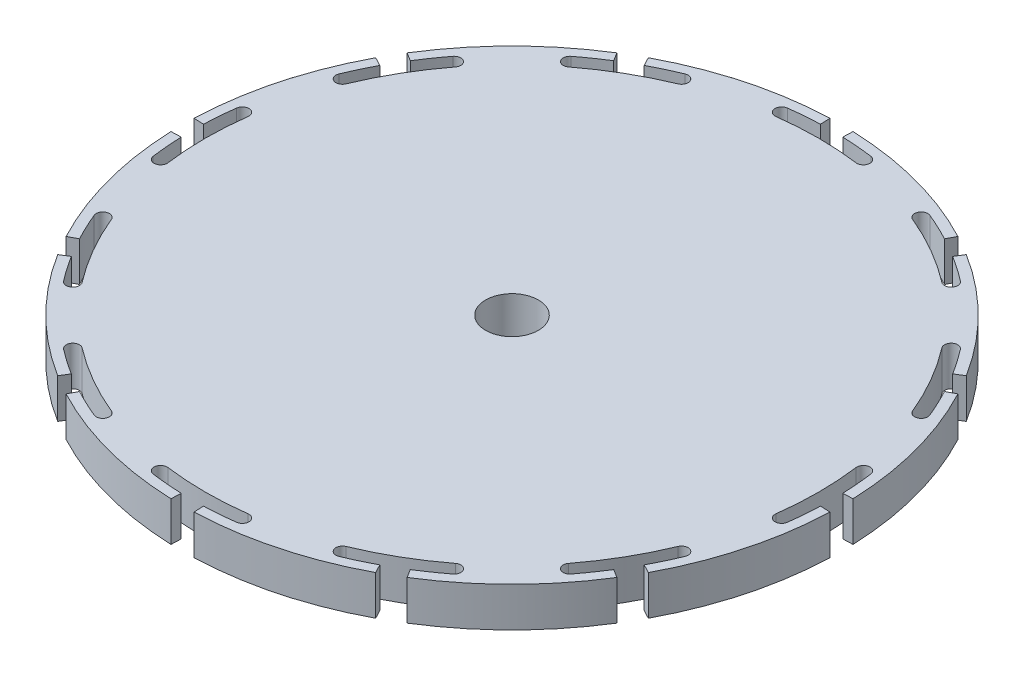
from build123d import *

# Parameters (mm, degrees)
SKETCH1_R           = 50
BOSS_EXTRUDE1_DEPTH = 6
CUT_EXTRUDE1_DEPTH  = 71.964779997
SKETCH3_R           = 4
CUT_EXTRUDE2_DEPTH  = 6


with BuildPart() as part:
    # Sketch1 → Boss-Extrude1 (new body)
    with BuildSketch(Plane(origin=(0, 0, 0), x_dir=(1, 0, 0), z_dir=(0, 1, 0))):
        Circle(SKETCH1_R)
    extrude(amount=BOSS_EXTRUDE1_DEPTH)

    # Sketch2 → Cut-Extrude1 (cut, through all)
    with BuildSketch(Plane(origin=(0, 0, 0), x_dir=(1, 0, 0), z_dir=(0, 1, 0))):
        with BuildLine():
            Line((-1.744974835, 49.969541351), (-1.69262559, 48.47045511))
            ThreePointArc((-1.69262559, 48.47045511), (-4.016198064, 48.333426871), (-6.330520323, 48.085075777))
            ThreePointArc((-6.330520323, 48.085075777), (-7.191438992, 46.963104723), (-6.069467938, 46.102186054))
            ThreePointArc((-6.069467938, 46.102186054), (0, 46.5), (6.069467938, 46.102186054))
            ThreePointArc((6.069467938, 46.102186054), (7.191438992, 46.963104723), (6.330520323, 48.085075777))
            ThreePointArc((6.330520323, 48.085075777), (4.016198064, 48.333426871), (1.69262559, 48.47045511))
            Line((1.69262559, 48.47045511), (1.744974835, 49.969541351))
            ThreePointArc((1.744974835, 49.969541351), (0, 50), (-1.744974835, 49.969541351))
        make_face()
        with BuildLine():
            Line((23.473578139, 44.147379643), (22.769370795, 42.822958254))
            ThreePointArc((22.769370795, 42.822958254), (20.688583885, 43.866074555), (18.56014647, 44.808157327))
            ThreePointArc((18.56014647, 44.808157327), (17.253583505, 44.266961227), (17.794779605, 42.960398262))
            ThreePointArc((17.794779605, 42.960398262), (23.25, 40.270181276), (28.307406449, 36.890930324))
            ThreePointArc((28.307406449, 36.890930324), (29.709521218, 37.075522235), (29.524929307, 38.477637004))
            ThreePointArc((29.524929307, 38.477637004), (27.644842986, 39.84987649), (25.701084315, 41.130332664))
            Line((25.701084315, 41.130332664), (26.495963212, 42.402404808))
            ThreePointArc((26.495963212, 42.402404808), (25, 43.301270189), (23.473578139, 44.147379643))
        make_face()
        with BuildLine():
            Line((42.402404808, 26.495963212), (41.130332664, 25.701084315))
            ThreePointArc((41.130332664, 25.701084315), (39.84987649, 27.644842986), (38.477637004, 29.524929307))
            ThreePointArc((38.477637004, 29.524929307), (37.075522235, 29.709521218), (36.890930324, 28.307406449))
            ThreePointArc((36.890930324, 28.307406449), (40.270181276, 23.25), (42.960398262, 17.794779605))
            ThreePointArc((42.960398262, 17.794779605), (44.266961227, 17.253583505), (44.808157327, 18.56014647))
            ThreePointArc((44.808157327, 18.56014647), (43.866074555, 20.688583885), (42.822958254, 22.769370795))
            Line((42.822958254, 22.769370795), (44.147379643, 23.473578139))
            ThreePointArc((44.147379643, 23.473578139), (43.301270189, 25), (42.402404808, 26.495963212))
        make_face()
        with BuildLine():
            Line((49.969541351, 1.744974835), (48.47045511, 1.69262559))
            ThreePointArc((48.47045511, 1.69262559), (48.333426871, 4.016198064), (48.085075777, 6.330520323))
            ThreePointArc((48.085075777, 6.330520323), (46.963104723, 7.191438992), (46.102186054, 6.069467938))
            ThreePointArc((46.102186054, 6.069467938), (46.5, 0), (46.102186054, -6.069467938))
            ThreePointArc((46.102186054, -6.069467938), (46.963104723, -7.191438992), (48.085075777, -6.330520323))
            ThreePointArc((48.085075777, -6.330520323), (48.333426871, -4.016198064), (48.47045511, -1.69262559))
            Line((48.47045511, -1.69262559), (49.969541351, -1.744974835))
            ThreePointArc((49.969541351, -1.744974835), (50, 0), (49.969541351, 1.744974835))
        make_face()
        with BuildLine():
            Line((44.147379643, -23.473578139), (42.822958254, -22.769370795))
            ThreePointArc((42.822958254, -22.769370795), (43.866074555, -20.688583885), (44.808157327, -18.56014647))
            ThreePointArc((44.808157327, -18.56014647), (44.266961227, -17.253583505), (42.960398262, -17.794779605))
            ThreePointArc((42.960398262, -17.794779605), (40.270181276, -23.25), (36.890930324, -28.307406449))
            ThreePointArc((36.890930324, -28.307406449), (37.075522235, -29.709521218), (38.477637004, -29.524929307))
            ThreePointArc((38.477637004, -29.524929307), (39.84987649, -27.644842986), (41.130332664, -25.701084315))
            Line((41.130332664, -25.701084315), (42.402404808, -26.495963212))
            ThreePointArc((42.402404808, -26.495963212), (43.301270189, -25), (44.147379643, -23.473578139))
        make_face()
        with BuildLine():
            Line((26.495963212, -42.402404808), (25.701084315, -41.130332664))
            ThreePointArc((25.701084315, -41.130332664), (27.644842986, -39.84987649), (29.524929307, -38.477637004))
            ThreePointArc((29.524929307, -38.477637004), (29.709521218, -37.075522235), (28.307406449, -36.890930324))
            ThreePointArc((28.307406449, -36.890930324), (23.25, -40.270181276), (17.794779605, -42.960398262))
            ThreePointArc((17.794779605, -42.960398262), (17.253583505, -44.266961227), (18.56014647, -44.808157327))
            ThreePointArc((18.56014647, -44.808157327), (20.688583885, -43.866074555), (22.769370795, -42.822958254))
            Line((22.769370795, -42.822958254), (23.473578139, -44.147379643))
            ThreePointArc((23.473578139, -44.147379643), (25, -43.301270189), (26.495963212, -42.402404808))
        make_face()
        with BuildLine():
            Line((1.744974835, -49.969541351), (1.69262559, -48.47045511))
            ThreePointArc((1.69262559, -48.47045511), (4.016198064, -48.333426871), (6.330520323, -48.085075777))
            ThreePointArc((6.330520323, -48.085075777), (7.191438992, -46.963104723), (6.069467938, -46.102186054))
            ThreePointArc((6.069467938, -46.102186054), (0, -46.5), (-6.069467938, -46.102186054))
            ThreePointArc((-6.069467938, -46.102186054), (-7.191438992, -46.963104723), (-6.330520323, -48.085075777))
            ThreePointArc((-6.330520323, -48.085075777), (-4.016198064, -48.333426871), (-1.69262559, -48.47045511))
            Line((-1.69262559, -48.47045511), (-1.744974835, -49.969541351))
            ThreePointArc((-1.744974835, -49.969541351), (0, -50), (1.744974835, -49.969541351))
        make_face()
        with BuildLine():
            Line((-23.473578139, -44.147379643), (-22.769370795, -42.822958254))
            ThreePointArc((-22.769370795, -42.822958254), (-20.688583885, -43.866074555), (-18.56014647, -44.808157327))
            ThreePointArc((-18.56014647, -44.808157327), (-17.253583505, -44.266961227), (-17.794779605, -42.960398262))
            ThreePointArc((-17.794779605, -42.960398262), (-23.25, -40.270181276), (-28.307406449, -36.890930324))
            ThreePointArc((-28.307406449, -36.890930324), (-29.709521218, -37.075522235), (-29.524929307, -38.477637004))
            ThreePointArc((-29.524929307, -38.477637004), (-27.644842986, -39.84987649), (-25.701084315, -41.130332664))
            Line((-25.701084315, -41.130332664), (-26.495963212, -42.402404808))
            ThreePointArc((-26.495963212, -42.402404808), (-25, -43.301270189), (-23.473578139, -44.147379643))
        make_face()
        with BuildLine():
            Line((-42.402404808, -26.495963212), (-41.130332664, -25.701084315))
            ThreePointArc((-41.130332664, -25.701084315), (-39.84987649, -27.644842986), (-38.477637004, -29.524929307))
            ThreePointArc((-38.477637004, -29.524929307), (-37.075522235, -29.709521218), (-36.890930324, -28.307406449))
            ThreePointArc((-36.890930324, -28.307406449), (-40.270181276, -23.25), (-42.960398262, -17.794779605))
            ThreePointArc((-42.960398262, -17.794779605), (-44.266961227, -17.253583505), (-44.808157327, -18.56014647))
            ThreePointArc((-44.808157327, -18.56014647), (-43.866074555, -20.688583885), (-42.822958254, -22.769370795))
            Line((-42.822958254, -22.769370795), (-44.147379643, -23.473578139))
            ThreePointArc((-44.147379643, -23.473578139), (-43.301270189, -25), (-42.402404808, -26.495963212))
        make_face()
        with BuildLine():
            Line((-49.969541351, -1.744974835), (-48.47045511, -1.69262559))
            ThreePointArc((-48.47045511, -1.69262559), (-48.333426871, -4.016198064), (-48.085075777, -6.330520323))
            ThreePointArc((-48.085075777, -6.330520323), (-46.963104723, -7.191438992), (-46.102186054, -6.069467938))
            ThreePointArc((-46.102186054, -6.069467938), (-46.5, 0), (-46.102186054, 6.069467938))
            ThreePointArc((-46.102186054, 6.069467938), (-46.963104723, 7.191438992), (-48.085075777, 6.330520323))
            ThreePointArc((-48.085075777, 6.330520323), (-48.333426871, 4.016198064), (-48.47045511, 1.69262559))
            Line((-48.47045511, 1.69262559), (-49.969541351, 1.744974835))
            ThreePointArc((-49.969541351, 1.744974835), (-50, 0), (-49.969541351, -1.744974835))
        make_face()
        with BuildLine():
            Line((-44.147379643, 23.473578139), (-42.822958254, 22.769370795))
            ThreePointArc((-42.822958254, 22.769370795), (-43.866074555, 20.688583885), (-44.808157327, 18.56014647))
            ThreePointArc((-44.808157327, 18.56014647), (-44.266961227, 17.253583505), (-42.960398262, 17.794779605))
            ThreePointArc((-42.960398262, 17.794779605), (-40.270181276, 23.25), (-36.890930324, 28.307406449))
            ThreePointArc((-36.890930324, 28.307406449), (-37.075522235, 29.709521218), (-38.477637004, 29.524929307))
            ThreePointArc((-38.477637004, 29.524929307), (-39.84987649, 27.644842986), (-41.130332664, 25.701084315))
            Line((-41.130332664, 25.701084315), (-42.402404808, 26.495963212))
            ThreePointArc((-42.402404808, 26.495963212), (-43.301270189, 25), (-44.147379643, 23.473578139))
        make_face()
        with BuildLine():
            Line((-26.495963212, 42.402404808), (-25.701084315, 41.130332664))
            ThreePointArc((-25.701084315, 41.130332664), (-27.644842986, 39.84987649), (-29.524929307, 38.477637004))
            ThreePointArc((-29.524929307, 38.477637004), (-29.709521218, 37.075522235), (-28.307406449, 36.890930324))
            ThreePointArc((-28.307406449, 36.890930324), (-23.25, 40.270181276), (-17.794779605, 42.960398262))
            ThreePointArc((-17.794779605, 42.960398262), (-17.253583505, 44.266961227), (-18.56014647, 44.808157327))
            ThreePointArc((-18.56014647, 44.808157327), (-20.688583885, 43.866074555), (-22.769370795, 42.822958254))
            Line((-22.769370795, 42.822958254), (-23.473578139, 44.147379643))
            ThreePointArc((-23.473578139, 44.147379643), (-25, 43.301270189), (-26.495963212, 42.402404808))
        make_face()
    extrude(amount=CUT_EXTRUDE1_DEPTH, mode=Mode.SUBTRACT)

    # Sketch3 → Cut-Extrude2 (cut)
    with BuildSketch(Plane(origin=(0, 0, 0), x_dir=(1, 0, 0), z_dir=(0, 1, 0))):
        Circle(SKETCH3_R)
    extrude(amount=CUT_EXTRUDE2_DEPTH, mode=Mode.SUBTRACT)


solid = part.part
